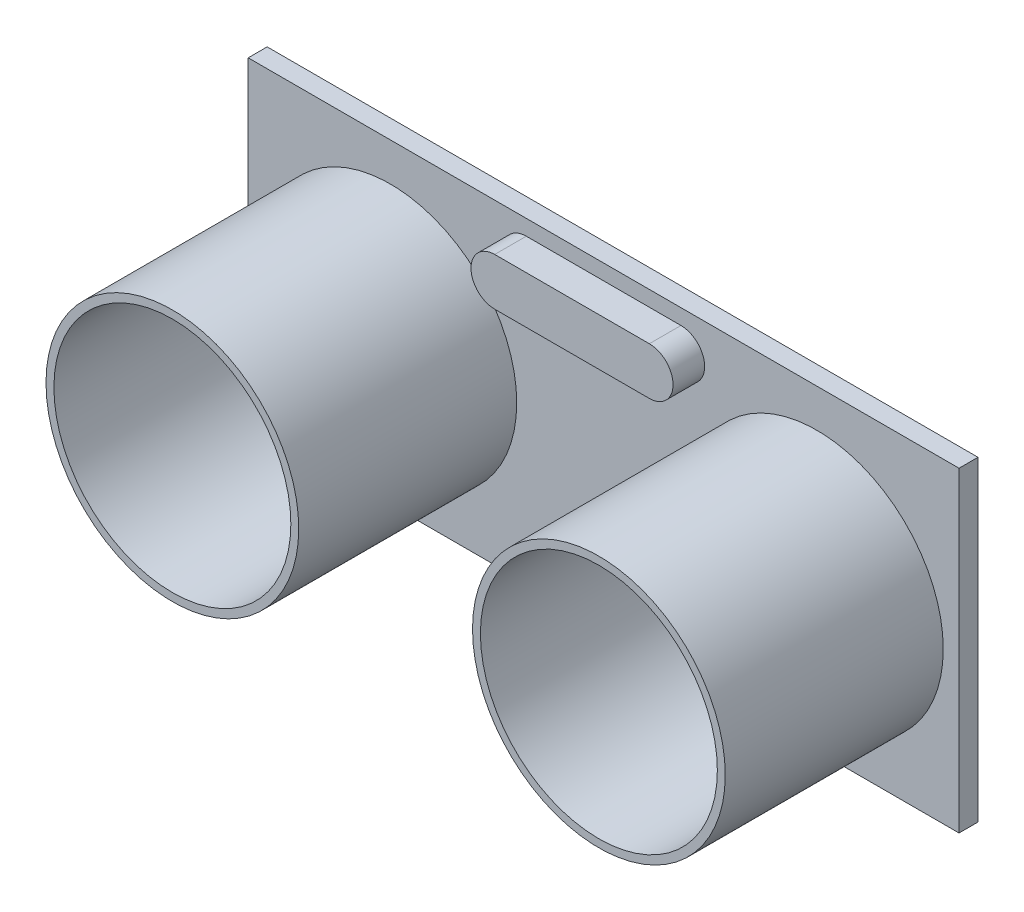
from build123d import *

# Parameters (mm, degrees)
ESQUISSE1_W             = 22.5
ESQUISSE1_H             = 20
BOSS_EXTRU_1_DEPTH      = 1.2
ESQUISSE2_R             = 8
BOSS_EXTRU_2_DEPTH      = 13.8
COQUE2_T                = -0.5
ESQUISSE3_R             = 1
ENL_V_MAT_EXTRU_1_DEPTH = 29.375992396
ESQUISSE4_R             = 0.5
ENL_V_MAT_EXTRU_2_DEPTH = 2.8
BOSS_EXTRU_3_DEPTH      = 2
SYM_TRIE1_START         = -1.2
SYM_TRIE1_OUTLINE_R     = 8
SYM_TRIE1_DEPTH         = 15
SYM_TRIE1_2_OUTLINE_W   = 22.5
SYM_TRIE1_2_OUTLINE_H   = 20
SYM_TRIE1_2_OUTLINE_R   = 0.5
SYM_TRIE1_2_OUTLINE_R_2 = 8
SYM_TRIE1_2_DEPTH       = 1.2
SYM_TRIE1_3_DEPTH       = 2
COQUE4_T                = -0.5


# Read off the part's stored shape, not the designer's step: Symétrie1
with BuildPart() as part:
    # Esquisse1 → Boss.-Extru.1 (new body)
    with BuildSketch(Plane.XY):
        with Locations((-11.25, 0.416666667)):
            Rectangle(ESQUISSE1_W, ESQUISSE1_H)
    extrude(amount=-BOSS_EXTRU_1_DEPTH)

    # Esquisse2 → Boss.-Extru.2 (add)
    with BuildSketch(Plane.XY):
        with Locations(Location((-13.5, 0, 0), (0, 0, 180))):
            Circle(ESQUISSE2_R)
    extrude(amount=BOSS_EXTRU_2_DEPTH)

    # Coque2
    coque2_openings = [part.faces().sort_by_distance(p)[0] for p in [
        (-13.5, 0, 13.8),
    ]]
    offset(amount=COQUE2_T, openings=coque2_openings, kind=Kind.INTERSECTION)

    # Esquisse3 → Enlèv. mat.-Extru.1 (cut, through all)
    with BuildSketch(Plane.XY):
        with Locations((-20.497748718, -7.838681671)):
            Circle(ESQUISSE3_R)
    extrude(amount=-ENL_V_MAT_EXTRU_1_DEPTH, mode=Mode.SUBTRACT)

    # Esquisse4 → Enlèv. mat.-Extru.2 (cut)
    with BuildSketch(Plane.XY):
        with Locations(Location((-3.75, -7.838681671, 0), (0, 0, 180))):
            Circle(ESQUISSE4_R)
        with Locations(Location((-1.875, -7.838681671, 0), (0, 0, 180))):
            Circle(ESQUISSE4_R)
    extrude(amount=-ENL_V_MAT_EXTRU_2_DEPTH, mode=Mode.SUBTRACT)

    # Esquisse5 → Boss.-Extru.3 (add)
    with BuildSketch(Plane.XY):
        with BuildLine():
            Line((0, 6.438889699), (-4.894980877, 6.438889699))
            ThreePointArc((-4.894980877, 6.438889699), (-6.394980877, 7.938889699), (-4.894980877, 9.438889699))
            Line((-4.894980877, 9.438889699), (0, 9.438889699))
            Line((0, 9.438889699), (0, 6.438889699))
        make_face()
    extrude(amount=BOSS_EXTRU_3_DEPTH)



with BuildPart() as body_2:
    # Symétrie1 outline → Symétrie1 (new body)
    with BuildSketch(Plane.XY.offset(SYM_TRIE1_START)):
        with Locations((13.5, 0)):
            Circle(SYM_TRIE1_OUTLINE_R)
    extrude(amount=SYM_TRIE1_DEPTH)


with BuildPart() as part_1:
    add(part.part)

    add(body_2.part)  # Sym_trie1 2 merges body 2
    # Sym_trie1 2 outline → Sym_trie1 2 (add)
    with BuildSketch(Plane.XY.offset(SYM_TRIE1_START)):
        with Locations((11.25, 0.416666667)):
            Rectangle(SYM_TRIE1_2_OUTLINE_W, SYM_TRIE1_2_OUTLINE_H)
        with Locations((1.875, -7.838681671)):
            Circle(SYM_TRIE1_2_OUTLINE_R, mode=Mode.SUBTRACT)
        with Locations((3.75, -7.838681671)):
            Circle(SYM_TRIE1_2_OUTLINE_R, mode=Mode.SUBTRACT)
        with Locations((13.5, 0)):
            Circle(SYM_TRIE1_2_OUTLINE_R_2, mode=Mode.SUBTRACT)
    extrude(amount=SYM_TRIE1_2_DEPTH)

    # Sym_trie1 3 outline → Sym_trie1 3 (add)
    with BuildSketch(Plane.XY):
        with BuildLine():
            Line((0, 9.438889699), (0, 6.438889699))
            Line((0, 6.438889699), (4.894980877, 6.438889699))
            ThreePointArc((4.894980877, 6.438889699), (6.394980877, 7.938889699), (4.894980877, 9.438889699))
            Line((4.894980877, 9.438889699), (0, 9.438889699))
        make_face()
    extrude(amount=SYM_TRIE1_3_DEPTH)

    # Coque4
    coque4_openings = [part_1.faces().sort_by_distance(p)[0] for p in [
        (13.5, 0, 13.8),
    ]]
    offset(amount=COQUE4_T, openings=coque4_openings, kind=Kind.INTERSECTION)


solid = part_1.part
